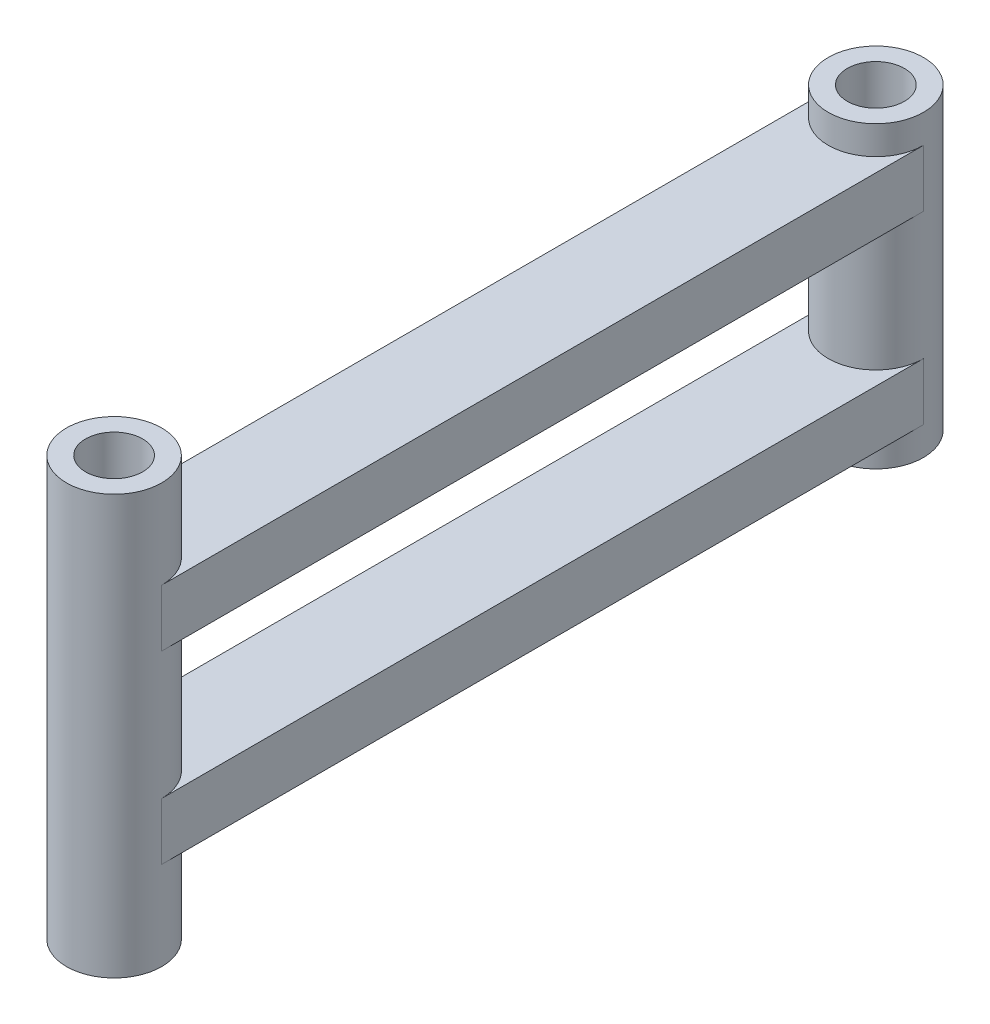
from build123d import *

# Parameters (mm, degrees)
BOSS_EXTRUDE1_DEPTH             = 3
BOSS_EXTRUDE2_DEPTH             = 7.85
BOSS_EXTRUDE2_DEPTH_BACK        = 7.85
BOSS_EXTRUDE2_START             = 3.35
SKETCH2_R                       = 2.5
BOSS_EXTRUDE3_START             = 9.7
BOSS_EXTRUDE3_DEPTH             = 3
BOSS_EXTRUDE4_DEPTH             = 11
BOSS_EXTRUDE4_DEPTH_BACK        = 11
BOSS_EXTRUDE4_START             = 3.35
SKETCH7_R                       = 2.5
F_3_0MM_CLEARANCE_DOWEL_HOLE3_D = 3


with BuildPart() as part:
    # Sketch1 → Boss-Extrude1 (new body)
    with BuildSketch(Plane(origin=(0, 0, 0), x_dir=(1, 0, 0), z_dir=(0, 1, 0))):
        with BuildLine():
            Line((2.5, 0), (2.5, -40))
            ThreePointArc((2.5, -40), (0, -42.5), (-2.5, -40))
            Line((-2.5, -40), (-2.5, 0))
            ThreePointArc((-2.5, 0), (0, 2.5), (2.5, 0))
        make_face()
    extrude(amount=BOSS_EXTRUDE1_DEPTH)

    # Sketch2 → Boss-Extrude2 (add, two sides: drawn at the far end of the back side and taken through both)
    with BuildSketch(Plane(origin=(0, 3, 0), x_dir=(1, 0, 0), z_dir=(0, 1, 0)).offset(BOSS_EXTRUDE2_START - BOSS_EXTRUDE2_DEPTH_BACK)):
        Circle(SKETCH2_R)
    extrude(amount=BOSS_EXTRUDE2_DEPTH + BOSS_EXTRUDE2_DEPTH_BACK)

    # Sketch1<3> → Boss-Extrude3 (add)
    with BuildSketch(Plane(origin=(0, 0, 0), x_dir=(1, 0, 0), z_dir=(0, 1, 0)).offset(BOSS_EXTRUDE3_START)):
        with BuildLine():
            Line((2.5, 0), (2.5, -40))
            ThreePointArc((2.5, -40), (0, -42.5), (-2.5, -40))
            Line((-2.5, -40), (-2.5, 0))
            ThreePointArc((-2.5, 0), (0, 2.5), (2.5, 0))
        make_face()
    extrude(amount=BOSS_EXTRUDE3_DEPTH)

    # Sketch7 → Boss-Extrude4 (add, two sides: drawn at the far end of the back side and taken through both)
    with BuildSketch(Plane(origin=(0, 3, 0), x_dir=(1, 0, 0), z_dir=(0, 1, 0)).offset(BOSS_EXTRUDE4_START - BOSS_EXTRUDE4_DEPTH_BACK)):
        with Locations((0, -40)):
            Circle(SKETCH7_R)
    extrude(amount=BOSS_EXTRUDE4_DEPTH + BOSS_EXTRUDE4_DEPTH_BACK)

    # Ø3.0mm Clearance Dowel Hole3 (through all)
    with Locations(Plane(origin=(0, 17.35, 0), x_dir=(1, 0, 0), z_dir=(0, 1, 0))):
        with Locations((0, -40), (0, 0)):
            Hole(F_3_0MM_CLEARANCE_DOWEL_HOLE3_D / 2)


solid = part.part
